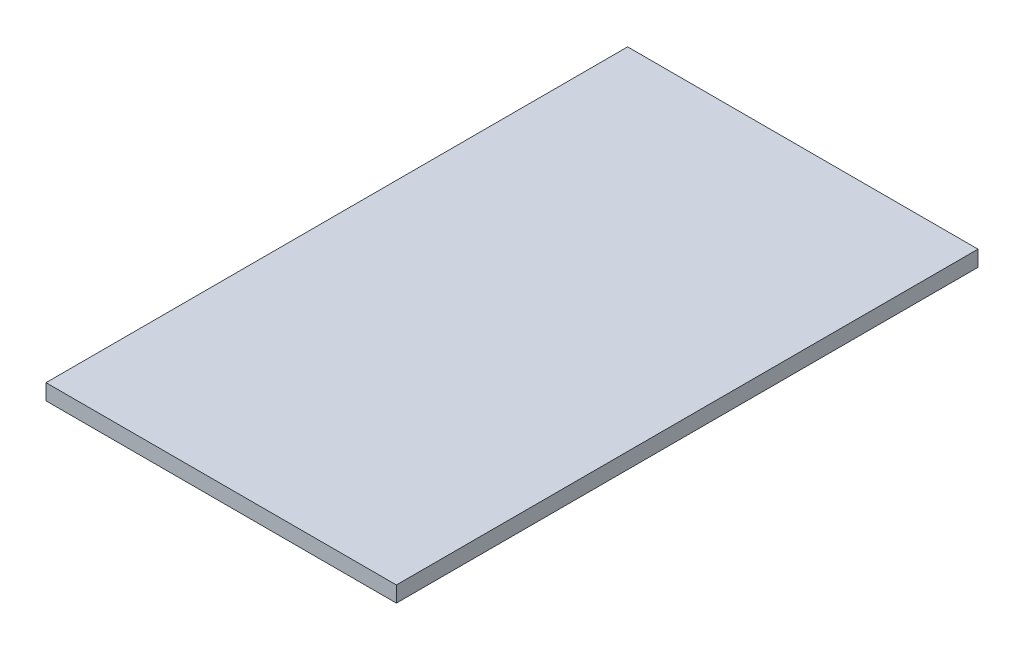
from build123d import *

# Parameters (mm, degrees)
SKETCH1_W           = 100
SKETCH1_H           = 166
MAIN_BODY_DEPTH     = 4.5
SKETCH2_W           = 72
SKETCH2_H           = 40
PCBS_AND_SUCH_DEPTH = 5


with BuildPart() as part:
    # Sketch1 → MAIN BODY (new body)
    with BuildSketch(Plane(origin=(0, 0, 0), x_dir=(1, 0, 0), z_dir=(0, 1, 0))):
        Rectangle(SKETCH1_W, SKETCH1_H)
    extrude(amount=MAIN_BODY_DEPTH)

    # Sketch2 → PCBs AND SUCH (add)
    with BuildSketch(Plane.XZ):
        with Locations((-10, -63)):
            Rectangle(SKETCH2_W, SKETCH2_H)
    extrude(amount=PCBS_AND_SUCH_DEPTH)


solid = part.part
